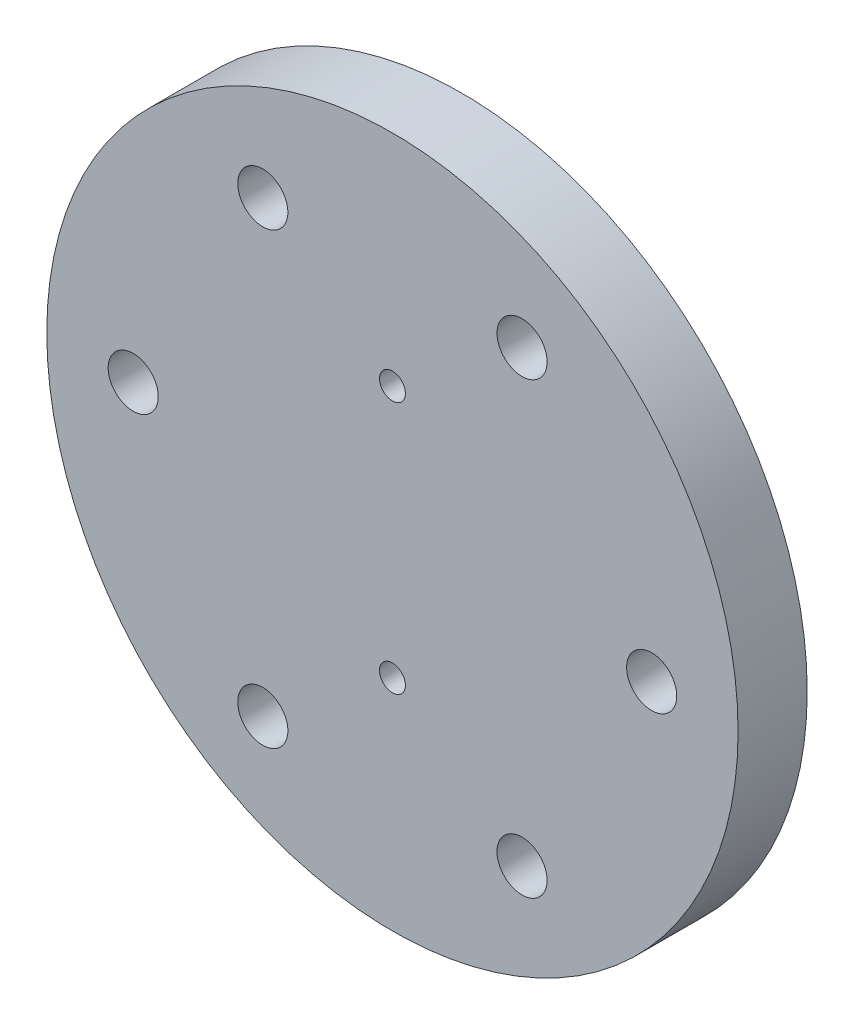
from build123d import *

# Parameters (mm, degrees)
BOSS_EXTRU_1_DEPTH       = 8
ENL_V_START              = -10
ESQUISSE2_R              = 120
ENL_V_MAT_EXTRU_1_DEPTH  = 10
D_GAGEMENT_M51_OUTLINE_R = 2.9
D_GAGEMENT_M51_DEPTH     = 8
ESQUISSE5_R              = 1.5
ENL_V_MAT_EXTRU_2_DEPTH  = 10


# Read off the part's stored shape, not the designer's step: Dégagement M51
with BuildPart() as part:
    # Esquisse1 → Boss.-Extru.1 (new body)
    with BuildSketch(Plane.XY):
        with BuildLine():
            Line((-20, 56.568542495), (-73.333333333, 37.712361663))
            ThreePointArc((-73.333333333, 37.712361663), (-100, 0), (-73.333333333, -37.712361663))
            Line((-73.333333333, -37.712361663), (-20, -56.568542495))
            ThreePointArc((-20, -56.568542495), (34.641016151, -48.989794856), (60, 0))
            ThreePointArc((60, 0), (34.641016151, 48.989794856), (-20, 56.568542495))
        make_face()
    extrude(amount=BOSS_EXTRU_1_DEPTH)

    # Esquisse2 → Enlèv. mat.-Extru.1 (cut)
    with BuildSketch(Plane.XY.offset(8).offset(ENL_V_START)):
        with Locations((-60, 0)):
            Circle(ESQUISSE2_R)
        with BuildLine():
            ThreePointArc((-73.333333333, 37.712361663), (-100, 0), (-73.333333333, -37.712361663))
            ThreePointArc((-73.333333333, -37.712361663), (-20, 0), (-73.333333333, 37.712361663))
        make_face(mode=Mode.SUBTRACT)
    extrude(amount=ENL_V_MAT_EXTRU_1_DEPTH, mode=Mode.SUBTRACT)

    # Dégagement M51 outline → Dégagement M51 (cut)
    with BuildSketch(Plane.XY):
        with Locations((-90, 0)):
            Circle(D_GAGEMENT_M51_OUTLINE_R)
        with Locations((-75, -25.980762114)):
            Circle(D_GAGEMENT_M51_OUTLINE_R)
        with Locations((-45, -25.980762114)):
            Circle(D_GAGEMENT_M51_OUTLINE_R)
        with Locations((-30, 0)):
            Circle(D_GAGEMENT_M51_OUTLINE_R)
        with Locations((-45, 25.980762114)):
            Circle(D_GAGEMENT_M51_OUTLINE_R)
        with Locations((-75, 25.980762114)):
            Circle(D_GAGEMENT_M51_OUTLINE_R)
    extrude(amount=D_GAGEMENT_M51_DEPTH, mode=Mode.SUBTRACT)

    # Esquisse5 → Enlèv. mat.-Extru.2 (cut)
    with BuildSketch(Plane(origin=(819.686269666, 1346.410161514, 0), x_dir=(0, -1, 0), z_dir=(0, 0, -1))):
        with Locations(Location((1331.784714909, 879.686269666, 0), (0, 0, 90))):
            Circle(ESQUISSE5_R)
        with Locations(Location((1361.034715705, 879.686269666, 0), (0, 0, 90))):
            Circle(ESQUISSE5_R)
    extrude(amount=-ENL_V_MAT_EXTRU_2_DEPTH, mode=Mode.SUBTRACT)


solid = part.part
